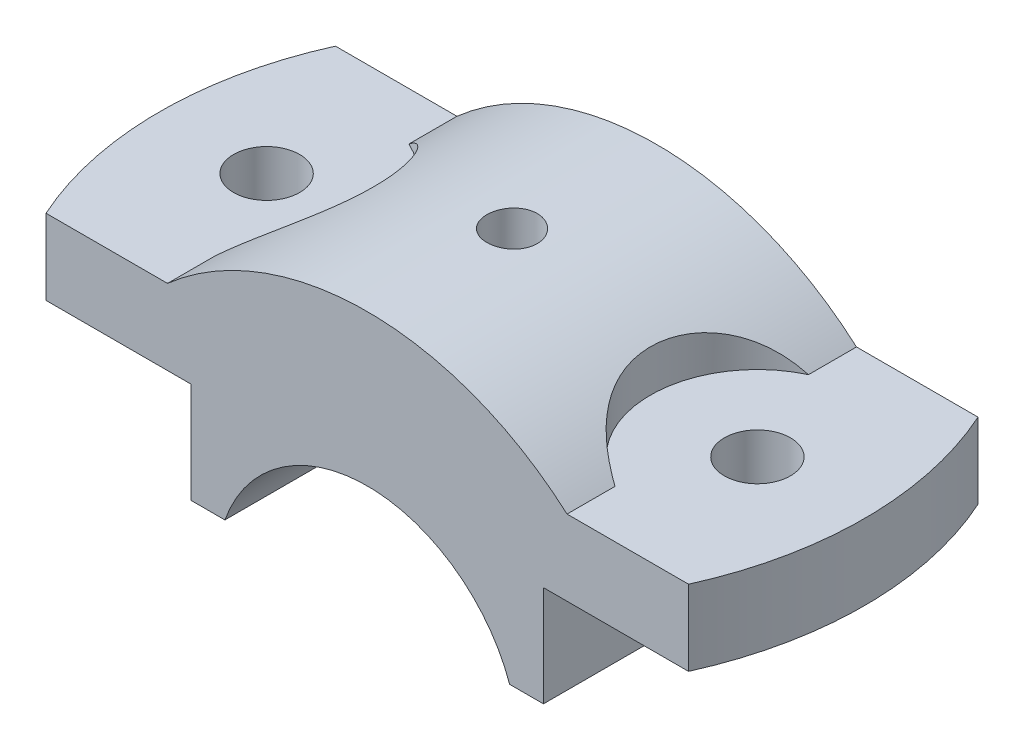
from build123d import *

# Parameters (mm, degrees)
BOSS_EXTRUDE1_DEPTH    = 23
CUT_EXTRUDE1_START     = -12
CUT_EXTRUDE1_DEPTH     = 12
SKETCH4_R              = 17
CUT_EXTRUDE2_DEPTH     = 46
M12X1_5_TAPPED_HOLE1_D = 10.5


# Read off the part's stored shape, not the designer's step: Cut-Extrude1
with BuildPart() as part:
    # Sketch1 → Boss-Extrude1 (new, symmetric)
    with BuildSketch(Plane.XY):
        with BuildLine():
            Line((56, 0), (56, 12))
            Line((56, 12), (31.749015733, 12))
            ThreePointArc((31.749015733, 12), (0, 24), (-31.749015733, 12))
            Line((-31.749015733, 12), (-56, 12))
            Line((-56, 12), (-56, 0))
            Line((-56, 0), (-28, 0))
            Line((-28, 0), (-28, -16))
            Line((-28, -16), (-22.627416998, -16))
            ThreePointArc((-22.627416998, -16), (0, 0), (22.627416998, -16))
            Line((22.627416998, -16), (28, -16))
            Line((28, -16), (28, 0))
            Line((28, 0), (56, 0))
        make_face()
    extrude(amount=BOSS_EXTRUDE1_DEPTH, both=True)

    # Cut-Extrude1 outline → Cut-Extrude1 (cut)
    with BuildSketch(Plane(origin=(0, 12, 0), x_dir=(1, 0, 0), z_dir=(0, 1, 0)).offset(CUT_EXTRUDE1_START)):
        with BuildLine():
            ThreePointArc((-56, 0), (-54.750763557, 11.762393036), (-51.058789645, 23))
            Line((-51.058789645, 23), (-56, 23))
            Line((-56, 23), (-56, 0))
        make_face()
        with BuildLine():
            ThreePointArc((-51.058789645, -23), (-54.750763557, -11.762393036), (-56, 0))
            Line((-56, 0), (-56, -23))
            Line((-56, -23), (-51.058789645, -23))
        make_face()
        with BuildLine():
            Line((56, 23), (51.058789645, 23))
            ThreePointArc((51.058789645, 23), (54.750763557, 11.762393036), (56, 0))
            Line((56, 0), (56, 23))
        make_face()
        with BuildLine():
            Line((56, -23), (56, 0))
            ThreePointArc((56, 0), (54.750763557, -11.762393036), (51.058789645, -23))
            Line((51.058789645, -23), (56, -23))
        make_face()
    extrude(amount=CUT_EXTRUDE1_DEPTH, mode=Mode.SUBTRACT)

    # Sketch4 → Cut-Extrude2 (cut)
    with BuildSketch(Plane(origin=(0, 12, 0), x_dir=(1, 0, 0), z_dir=(0, 1, 0))):
        with Locations((39, 0)):
            Circle(SKETCH4_R)
        with Locations((-39, 0)):
            Circle(SKETCH4_R)
    extrude(amount=CUT_EXTRUDE2_DEPTH, mode=Mode.SUBTRACT)

    # M12x1.5 Tapped Hole1 (through all)
    with Locations(Plane(origin=(39, 12, 0), x_dir=(1, 0, 0), z_dir=(0, 1, 0))):
        with Locations((0, 0)):
            m12x1_5_tapped_hole1 = Hole(M12X1_5_TAPPED_HOLE1_D / 2)

    # Mirror1: M12x1.5 Tapped Hole1 across plane
    add(m12x1_5_tapped_hole1.mirror(Plane(origin=(0, 0, 0), x_dir=(0, 0, 1), z_dir=(1, 0, 0))), mode=Mode.SUBTRACT)

    # Sketch7 → Cut-Revolve4 (revolve, cut)
    with BuildSketch(Plane.XY, mode=Mode.PRIVATE) as cut_revolve4_sk:
        Polygon((0, 24), (4, 24), (4, 8), (3, 8), (3, -2.439893383), (0, -2.439893383), align=None)
    revolve(cut_revolve4_sk.sketch.rotate(Axis((0, 0, 0), (0, 1, 0)), 90), axis=Axis((0, 0, 0), (0, 1, 0)), mode=Mode.SUBTRACT)


solid = part.part
